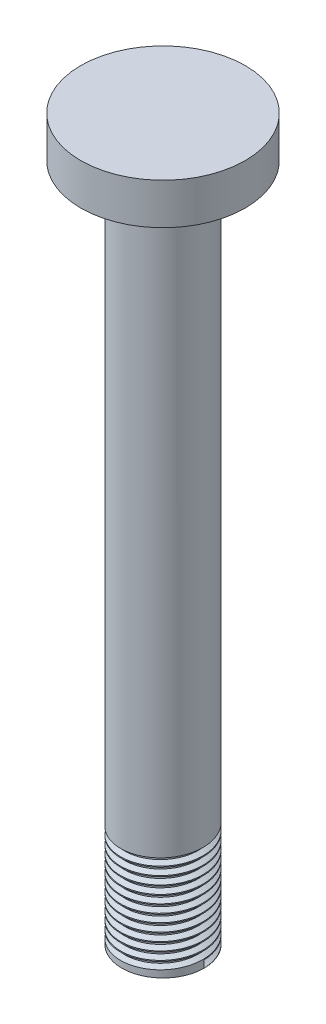
from build123d import *

# Parameters (mm, degrees)
SKETCH1_R           = 4
BOSS_EXTRUDE1_DEPTH = 2
SKETCH2_R           = 2
BOSS_EXTRUDE2_DEPTH = 33
THREAD1_PITCH       = 0.396875


with BuildPart() as part:
    # Sketch1 → Boss-Extrude1 (new body)
    with BuildSketch(Plane(origin=(0, 0, 0), x_dir=(1, 0, 0), z_dir=(0, 1, 0))):
        with Locations(Location((0, 0, 0), (0, 0, 270))):
            Circle(SKETCH1_R)
    extrude(amount=BOSS_EXTRUDE1_DEPTH)

    # Sketch2 → Boss-Extrude2 (add)
    with BuildSketch(Plane.XZ):
        with Locations(Location((0, 0, 0), (0, 0, 270))):
            Circle(SKETCH2_R)
    extrude(amount=BOSS_EXTRUDE2_DEPTH)

    # Thread1: the profile of Thread Profile1 profile screwed along a right-hand helix of 12.598425 turns, 6 arcs to a turn; built about Z, then put on its axis
    thread1_z = Axis((0, 0, 0), (0, 0, 1))
    thread1_corners = [(2.0003, 0, -0.000173205), (2.0003, 0, 0.347438829), (1.785185106, 0, 0.223242187), (1.785185106, 0, 0.124023437)]
    with BuildLine(mode=Mode.PRIVATE) as thread1_profile:
        Line(thread1_corners[0], thread1_corners[1])
        Line(thread1_corners[1], thread1_corners[2])
        Line(thread1_corners[2], thread1_corners[3])
        Line(thread1_corners[3], thread1_corners[0])
    thread1_cap = Face(thread1_profile.wire())
    thread1_turn_angles = [0, 30, 60, 90, 120, 150, 180, 210, 240, 270, 300, 330, 360]
    thread1_turn_weights = [1, 0.8660254037844387, 1, 0.8660254037844387, 1, 0.8660254037844387, 1, 0.8660254037844387, 1, 0.8660254037844387, 1, 0.8660254037844387, 1]
    thread1_turn_rails = [Edge.make_bspline([Vector(p[0], p[1], 0).rotate(thread1_z, thread1_turn_angles[k]) / thread1_turn_weights[k] + Vector(0, 0, p[2] + THREAD1_PITCH * thread1_turn_angles[k] / 360) for k in range(13)], [0, 0, 0, 1, 1, 2, 2, 3, 3, 4, 4, 5, 5, 6, 6, 6], 2, thread1_turn_weights) for p in thread1_corners]
    thread1_turn_sides = [Face.make_surface_from_curves(thread1_turn_rails[p[0]], thread1_turn_rails[p[1]]) for p in [(0, 1), (1, 2), (2, 3), (3, 0)]]
    thread1_last_angles = [4320, 4350, 4380, 4410, 4440, 4470, 4500, 4517.716535433, 4535.433070866]
    thread1_last_weights = [1, 0.8660254037844387, 1, 0.8660254037844387, 1, 0.8660254037844387, 1, 0.9525736983244454, 1]
    thread1_last_rails = [Edge.make_bspline([Vector(p[0], p[1], 0).rotate(thread1_z, thread1_last_angles[k]) / thread1_last_weights[k] + Vector(0, 0, p[2] + THREAD1_PITCH * thread1_last_angles[k] / 360) for k in range(9)], [0, 0, 0, 1, 1, 2, 2, 3, 3, 4, 4, 4], 2, thread1_last_weights) for p in thread1_corners]
    thread1_last_sides = [Face.make_surface_from_curves(thread1_last_rails[p[0]], thread1_last_rails[p[1]]) for p in [(0, 1), (1, 2), (2, 3), (3, 0)]]
    thread1 = Plane(origin=(0, -33, 0), x_dir=(1, 0, 0), z_dir=(0, 1, 0)) * Solid(Shell([*[p.moved(Location((0, 0, THREAD1_PITCH * i))) for i in range(12) for p in thread1_turn_sides], *thread1_last_sides, thread1_cap, thread1_cap.rotate(thread1_z, 4535.433070866).moved(Location((0, 0, THREAD1_PITCH * 4535.433070866 / 360)))]))
    add(thread1, mode=Mode.SUBTRACT)


solid = part.part
